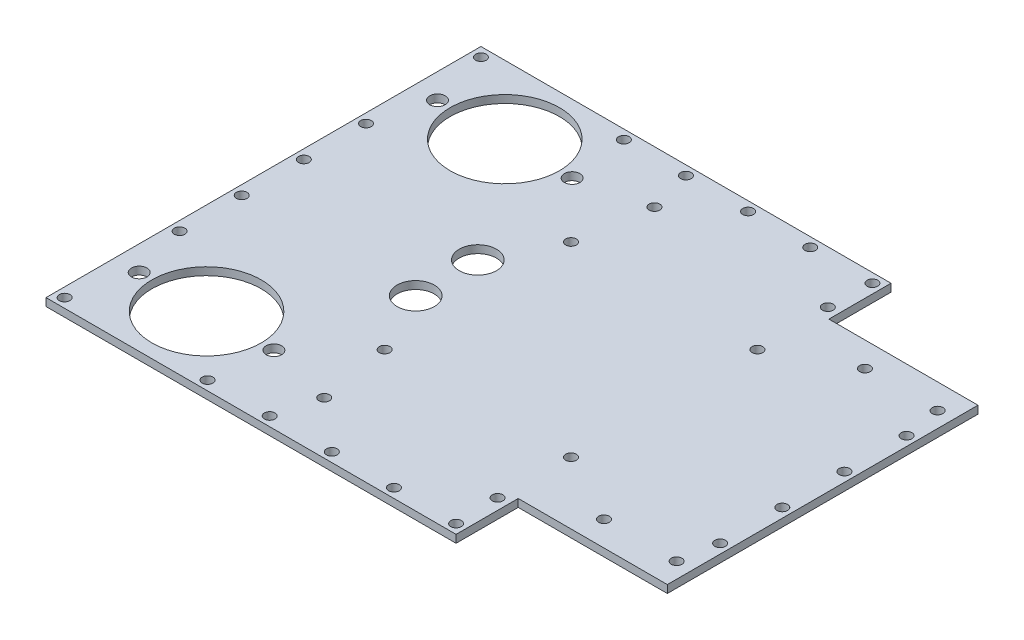
from build123d import *

# Parameters (mm, degrees)
SKETCH1_W           = 228.6
SKETCH1_H           = 177.8
BOSS_EXTRUDE1_DEPTH = 3.175
SKETCH2_R           = 2.1717
SKETCH2_R_2         = 3.175
SKETCH2_R_3         = 22.352
SKETCH2_R_4         = 2.159
SKETCH2_R_5         = 7.62
SKETCH2_W           = 60.96
SKETCH2_H           = 25.4
CUT_EXTRUDE1_DEPTH  = 3.175


with BuildPart() as part:
    # Sketch1 → Boss-Extrude1 (new body)
    with BuildSketch(Plane(origin=(0, 0, 0), x_dir=(1, 0, 0), z_dir=(0, 1, 0))):
        with Locations((-103.587357149, -18.25946167)):
            Rectangle(SKETCH1_W, SKETCH1_H)
    extrude(amount=BOSS_EXTRUDE1_DEPTH)

    # Sketch2 → Cut-Extrude1 (cut)
    with BuildSketch(Plane(origin=(0, 3.175, 0), x_dir=(1, 0, 0), z_dir=(0, 1, 0))):
        with Locations((4.362642851, 35.08053833)):
            Circle(SKETCH2_R)
        with Locations((-25.355357149, 35.08053833)):
            Circle(SKETCH2_R)
        with Locations((4.362642851, -71.59946167)):
            Circle(SKETCH2_R)
        with Locations((-25.355357149, -71.59946167)):
            Circle(SKETCH2_R)
        with Locations((-207.727357149, 42.70053833)):
            Circle(SKETCH2_R_2)
        with Locations((-152.660157149, 42.70053833)):
            Circle(SKETCH2_R_2)
        with Locations((-180.193757149, 42.70053833)):
            Circle(SKETCH2_R_3)
        with Locations((-207.727357149, -79.21946167)):
            Circle(SKETCH2_R_2)
        with Locations((-180.193757149, -79.21946167)):
            Circle(SKETCH2_R_3)
        with Locations((-152.660157149, -79.21946167)):
            Circle(SKETCH2_R_2)
        with Locations((-54.692357149, 49.24054303)):
            Circle(SKETCH2_R)
        with Locations((-125.558357149, 49.24054303)):
            Circle(SKETCH2_R)
        with Locations((-125.558357149, -85.75946637)):
            Circle(SKETCH2_R)
        with Locations((-54.692357149, -85.75946637)):
            Circle(SKETCH2_R)
        with Locations((-54.057357149, 66.83053833)):
            Circle(SKETCH2_R_4)
        with Locations((-54.057357149, -103.34946167)):
            Circle(SKETCH2_R_4)
        with Locations((-214.077357149, 66.83053833)):
            Circle(SKETCH2_R_4)
        with Locations((-214.077357149, -103.34946167)):
            Circle(SKETCH2_R)
        with Locations((-79.457357149, 66.83053833)):
            Circle(SKETCH2_R)
        with Locations((-104.857357149, 66.83053833)):
            Circle(SKETCH2_R)
        with Locations((-130.257357149, 66.83053833)):
            Circle(SKETCH2_R)
        with Locations((-155.657357149, 66.83053833)):
            Circle(SKETCH2_R)
        with Locations((-79.457357149, -103.34946167)):
            Circle(SKETCH2_R)
        with Locations((-104.857357149, -103.34946167)):
            Circle(SKETCH2_R)
        with Locations((-130.257357149, -103.34946167)):
            Circle(SKETCH2_R)
        with Locations((-155.657357149, -103.34946167)):
            Circle(SKETCH2_R)
        with Locations((-214.077357149, 19.84053833)):
            Circle(SKETCH2_R)
        with Locations((-214.077357149, -5.55946167)):
            Circle(SKETCH2_R)
        with Locations((-214.077357149, -30.95946167)):
            Circle(SKETCH2_R)
        with Locations((-214.077357149, -56.35946167)):
            Circle(SKETCH2_R)
        with Locations((-130.257357149, 19.84053833)):
            Circle(SKETCH2_R)
        with Locations((-130.257357149, -56.35946167)):
            Circle(SKETCH2_R)
        with Locations((6.902642851, 19.84053833)):
            Circle(SKETCH2_R)
        with Locations((6.902642851, -5.55946167)):
            Circle(SKETCH2_R)
        with Locations((6.902642851, -30.95946167)):
            Circle(SKETCH2_R)
        with Locations((6.902642851, -56.35946167)):
            Circle(SKETCH2_R)
        with Locations((-54.057357149, 19.84053833)):
            Circle(SKETCH2_R)
        with Locations((-54.057357149, -56.35946167)):
            Circle(SKETCH2_R)
        with Locations((-142.957357149, -30.95946167)):
            Circle(SKETCH2_R_5)
        with Locations((-142.957357149, -5.55946167)):
            Circle(SKETCH2_R_5)
        with Locations((-19.767357149, -94.45946167)):
            Rectangle(SKETCH2_W, SKETCH2_H)
        with Locations((-19.767357149, 57.94053833)):
            Rectangle(SKETCH2_W, SKETCH2_H)
    extrude(amount=-CUT_EXTRUDE1_DEPTH, mode=Mode.SUBTRACT)


solid = part.part
